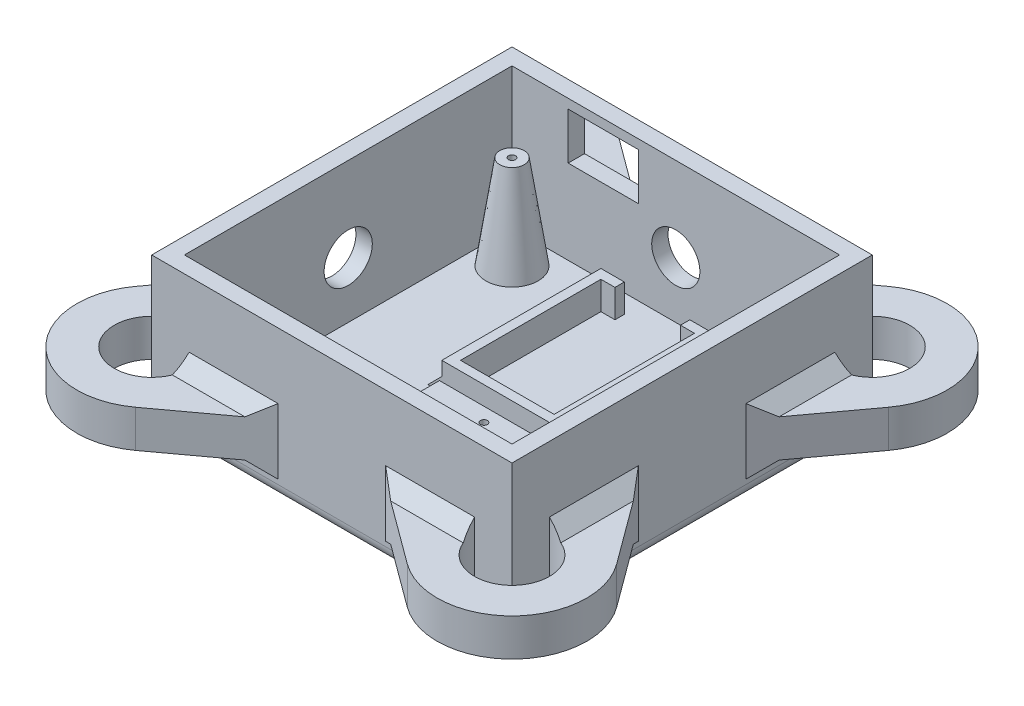
from build123d import *

# Parameters (mm, degrees)
SKETCH1_W            = 77
SKETCH1_H            = 77
SKETCH1_W_2          = 70
SKETCH1_H_2          = 70
BOSS_EXTRUDE1_DEPTH  = 30
SKETCH2_W            = 77
SKETCH2_H            = 77
BOSS_EXTRUDE2_DEPTH  = 2
SKETCH3_R            = 2.6
SKETCH3_R_2          = 0.75
BOSS_EXTRUDE3_DEPTH  = 20
FILLET1_R            = 3
BOSS_EXTRUDE8_DEPTH  = 6
SKETCH15_R           = 5.15
CUT_EXTRUDE2_DEPTH   = 3.5
BOSS_EXTRUDE9_DEPTH  = 8
CHAMFER1_SIZE        = 3
CHAMFER2_SIZE        = 3
SKETCH18_W           = 25
SKETCH18_H           = 32
BOSS_EXTRUDE10_DEPTH = 2
SKETCH19_R           = 0.75
CUT_EXTRUDE3_DEPTH   = 83.003048724
SKETCH20_R           = 5.15
CUT_EXTRUDE4_DEPTH   = 3.5
CHAMFER3_SIZE        = 3
CHAMFER3_SIZE_2      = 20
SKETCH21_W           = 15
SKETCH21_H           = 10
CUT_EXTRUDE5_DEPTH   = 3.5


with BuildPart() as part:
    # Sketch1 → Boss-Extrude1 (new body)
    with BuildSketch(Plane(origin=(0, 0, 0), x_dir=(1, 0, 0), z_dir=(0, 1, 0))):
        Rectangle(SKETCH1_W, SKETCH1_H)
        Rectangle(SKETCH1_W_2, SKETCH1_H_2, mode=Mode.SUBTRACT)
    extrude(amount=BOSS_EXTRUDE1_DEPTH)

    # Sketch2 → Boss-Extrude2 (add)
    with BuildSketch(Plane.XZ):
        Rectangle(SKETCH2_W, SKETCH2_H)
    extrude(amount=BOSS_EXTRUDE2_DEPTH)

    # Sketch3 → Boss-Extrude3 (add)
    # profile 1 of 4: a face of its own
    with BuildSketch(Plane(origin=(0, 0, 0), x_dir=(1, 0, 0), z_dir=(0, 1, 0))):
        with Locations(Location((28, 28, 0), (0, 0, 90))):
            Circle(SKETCH3_R)
        with Locations(Location((28, 28, 0), (0, 0, 270))):
            Circle(SKETCH3_R_2, mode=Mode.SUBTRACT)
    # profile 2 of 4: a face of its own
    with BuildSketch(Plane(origin=(0, 0, 0), x_dir=(1, 0, 0), z_dir=(0, 1, 0))):
        with Locations(Location((28, -28, 0), (0, 0, 90))):
            Circle(SKETCH3_R)
        with Locations(Location((28, -28, 0), (0, 0, 90))):
            Circle(SKETCH3_R_2, mode=Mode.SUBTRACT)
    # profile 3 of 4: a face of its own
    with BuildSketch(Plane(origin=(0, 0, 0), x_dir=(1, 0, 0), z_dir=(0, 1, 0))):
        with Locations(Location((-28, -28, 0), (0, 0, 90))):
            Circle(SKETCH3_R)
        with Locations(Location((-28, -28, 0), (0, 0, 270))):
            Circle(SKETCH3_R_2, mode=Mode.SUBTRACT)
    # profile 4 of 4: a face of its own
    with BuildSketch(Plane(origin=(0, 0, 0), x_dir=(1, 0, 0), z_dir=(0, 1, 0))):
        with Locations(Location((-28, 28, 0), (0, 0, 90))):
            Circle(SKETCH3_R)
        with Locations(Location((-28, 28, 0), (0, 0, 90))):
            Circle(SKETCH3_R_2, mode=Mode.SUBTRACT)
    extrude(amount=BOSS_EXTRUDE3_DEPTH)

    # Fillet1
    fillet1_edges = [part.edges().sort_by_distance(p)[0] for p in [
        (-38.5, -2, 0),
        (0, -2, -38.5),
        (38.5, -2, 0),
        (0, -2, 38.5),
    ]]
    fillet(fillet1_edges, radius=FILLET1_R)

    # Sketch11 → Boss-Extrude8 (add)
    with BuildSketch(Plane(origin=(0, 0, 0), x_dir=(1, 0, 0), z_dir=(0, 1, 0))):
        Polygon((-7, 31), (-7, 29), (-10, 29), (-10, -1), (10, -1), (10, 29), (7, 29), (7, 31), (12, 31), (12, -3), (-12, -3), (-12, 31), align=None)
    extrude(amount=BOSS_EXTRUDE8_DEPTH)

    # Sketch15 → Cut-Extrude2 (cut)
    with BuildSketch(Plane(origin=(0, 0, -38.5), x_dir=(-1, 0, 0), z_dir=(0, 0, -1))):
        with Locations((0, 12)):
            Circle(SKETCH15_R)
    extrude(amount=-CUT_EXTRUDE2_DEPTH, mode=Mode.SUBTRACT)

    # Sketch17 → Boss-Extrude9 (add)
    with BuildSketch(Plane(origin=(0, 5, 0), x_dir=(-1, 0, 0), z_dir=(0, -1, 0))):
        with BuildLine():
            Line((38.5, 22.5), (38.5, 11.5))
            Line((38.5, 11.5), (51.388037435, 29.018518519))
            ThreePointArc((51.388037435, 29.018518519), (49.813708499, 49.813708499), (29.018518519, 51.388037435))
            Line((29.018518519, 51.388037435), (11.5, 38.5))
            Line((11.5, 38.5), (22.5, 38.5))
            Line((22.5, 38.5), (30.5, 38.5))
            ThreePointArc((30.5, 38.5), (44.156854249, 44.156854249), (38.5, 30.5))
            Line((38.5, 30.5), (38.5, 22.5))
        make_face()
        with BuildLine():
            Line((-38.5, 30.5), (-38.5, 22.5))
            Line((-38.5, 22.5), (-38.5, 11.5))
            Line((-38.5, 11.5), (-51.388037435, 29.018518519))
            ThreePointArc((-51.388037435, 29.018518519), (-49.813708499, 49.813708499), (-29.018518519, 51.388037435))
            Line((-29.018518519, 51.388037435), (-11.5, 38.5))
            Line((-11.5, 38.5), (-22.5, 38.5))
            Line((-22.5, 38.5), (-30.5, 38.5))
            ThreePointArc((-30.5, 38.5), (-44.156854249, 44.156854249), (-38.5, 30.5))
        make_face()
        with BuildLine():
            Line((38.5, -30.5), (38.5, -22.5))
            Line((38.5, -22.5), (38.5, -11.5))
            Line((38.5, -11.5), (51.388037435, -29.018518519))
            ThreePointArc((51.388037435, -29.018518519), (49.813708499, -49.813708499), (29.018518519, -51.388037435))
            Line((29.018518519, -51.388037435), (11.5, -38.5))
            Line((11.5, -38.5), (22.5, -38.5))
            Line((22.5, -38.5), (30.5, -38.5))
            ThreePointArc((30.5, -38.5), (44.156854249, -44.156854249), (38.5, -30.5))
        make_face()
        with BuildLine():
            Line((-22.5, -38.5), (-30.5, -38.5))
            ThreePointArc((-30.5, -38.5), (-44.156854249, -44.156854249), (-38.5, -30.5))
            Line((-38.5, -30.5), (-38.5, -22.5))
            Line((-38.5, -22.5), (-38.5, -11.5))
            Line((-38.5, -11.5), (-51.388037435, -29.018518519))
            ThreePointArc((-51.388037435, -29.018518519), (-49.813708499, -49.813708499), (-29.018518519, -51.388037435))
            Line((-29.018518519, -51.388037435), (-11.5, -38.5))
            Line((-11.5, -38.5), (-22.5, -38.5))
        make_face()
    extrude(amount=-BOSS_EXTRUDE9_DEPTH)

    # Chamfer1
    chamfer1_edges = [part.edges().sort_by_distance(p)[0] for p in [
        (-38.5, 13, -21),
        (-21, 13, -38.5),
        (-21, 5, -38.5),
        (-38.5, 5, -21),
        (38.5, 13, -21),
        (21, 13, -38.5),
        (21, 5, -38.5),
        (38.5, 5, -21),
        (-38.5, 13, 21),
        (-21, 13, 38.5),
        (-21, 5, 38.5),
        (-38.5, 5, 21),
        (21, 13, 38.5),
        (38.5, 13, 21),
        (38.5, 5, 21),
        (21, 5, 38.5),
    ]]
    chamfer(chamfer1_edges, length=CHAMFER1_SIZE)

    # Chamfer2
    chamfer2_edges = [part.edges().sort_by_distance(p)[0] for p in [
        (-12, 0, -14),
        (12, 0, -14),
    ]]
    chamfer(chamfer2_edges, length=CHAMFER2_SIZE)

    # Sketch18 → Boss-Extrude10 (add)
    with BuildSketch(Plane(origin=(0, 0, 0), x_dir=(1, 0, 0), z_dir=(0, 1, 0))):
        with Locations((0, -19)):
            Rectangle(SKETCH18_W, SKETCH18_H)
    extrude(amount=BOSS_EXTRUDE10_DEPTH)

    # Sketch19 → Cut-Extrude3 (cut, through all)
    with BuildSketch(Plane(origin=(0, 2, 0), x_dir=(1, 0, 0), z_dir=(0, 1, 0))):
        with Locations(Location((0, -6, 0), (0, 0, 270))):
            Circle(SKETCH19_R)
        with Locations(Location((0, -32, 0), (0, 0, 270))):
            Circle(SKETCH19_R)
    extrude(amount=-CUT_EXTRUDE3_DEPTH, mode=Mode.SUBTRACT)

    # Sketch20 → Cut-Extrude4 (cut)
    with BuildSketch(Plane.ZY.offset(38.5)):
        with Locations((0, 12)):
            Circle(SKETCH20_R)
    extrude(amount=-CUT_EXTRUDE4_DEPTH, mode=Mode.SUBTRACT)

    # Chamfer3
    # the kernel refuses this chamfer: 20, 3 mm, written as the material it adds along each edge
    with BuildSketch(Plane(origin=(28, 0, -28), x_dir=(0, 0, -1), z_dir=(1, 0, 0))) as chamfer3_piece_1_section:
        Polygon((2.6 + CHAMFER3_SIZE, 0), (2.6, CHAMFER3_SIZE_2), (2.6, 0), align=None)
    chamfer3_piece_1 = revolve(axis=Axis((28, 0, -28), (0, 1, 0)), mode=Mode.PRIVATE)
    chamfer3_piece_1 = split(chamfer3_piece_1, bisect_by=Plane(origin=(28, 20, -23.934343061), z_dir=(0, -1, 0)), keep=Keep.TOP, mode=Mode.PRIVATE)
    add(chamfer3_piece_1)
    with BuildSketch(Plane(origin=(28, 0, 28), x_dir=(0, 0, -1), z_dir=(1, 0, 0))) as chamfer3_piece_2_section:
        Polygon((2.6 + CHAMFER3_SIZE, 0), (2.6, CHAMFER3_SIZE_2), (2.6, 0), align=None)
    chamfer3_piece_2 = revolve(axis=Axis((28, 0, 28), (0, 1, 0)), mode=Mode.PRIVATE)
    chamfer3_piece_2 = split(chamfer3_piece_2, bisect_by=Plane(origin=(28, 20, 32.065656938), z_dir=(0, -1, 0)), keep=Keep.TOP, mode=Mode.PRIVATE)
    add(chamfer3_piece_2)
    with BuildSketch(Plane(origin=(-28, 0, 28), x_dir=(0, 0, -1), z_dir=(1, 0, 0))) as chamfer3_piece_3_section:
        Polygon((2.6 + CHAMFER3_SIZE, 0), (2.6, CHAMFER3_SIZE_2), (2.6, 0), align=None)
    chamfer3_piece_3 = revolve(axis=Axis((-28, 0, 28), (0, 1, 0)), mode=Mode.PRIVATE)
    chamfer3_piece_3 = split(chamfer3_piece_3, bisect_by=Plane(origin=(-28, 20, 32.065656938), z_dir=(0, -1, 0)), keep=Keep.TOP, mode=Mode.PRIVATE)
    add(chamfer3_piece_3)
    with BuildSketch(Plane(origin=(-28, 0, -28), x_dir=(0, 0, -1), z_dir=(1, 0, 0))) as chamfer3_piece_4_section:
        Polygon((2.6 + CHAMFER3_SIZE, 0), (2.6, CHAMFER3_SIZE_2), (2.6, 0), align=None)
    chamfer3_piece_4 = revolve(axis=Axis((-28, 0, -28), (0, 1, 0)), mode=Mode.PRIVATE)
    chamfer3_piece_4 = split(chamfer3_piece_4, bisect_by=Plane(origin=(-28, 20, -23.934343061), z_dir=(0, -1, 0)), keep=Keep.TOP, mode=Mode.PRIVATE)
    add(chamfer3_piece_4)

    # Sketch21 → Cut-Extrude5 (cut)
    with BuildSketch(Plane.XY.offset(-35)):
        with Locations((-15.5, 23)):
            Rectangle(SKETCH21_W, SKETCH21_H)
    extrude(amount=-CUT_EXTRUDE5_DEPTH, mode=Mode.SUBTRACT)


solid = part.part
